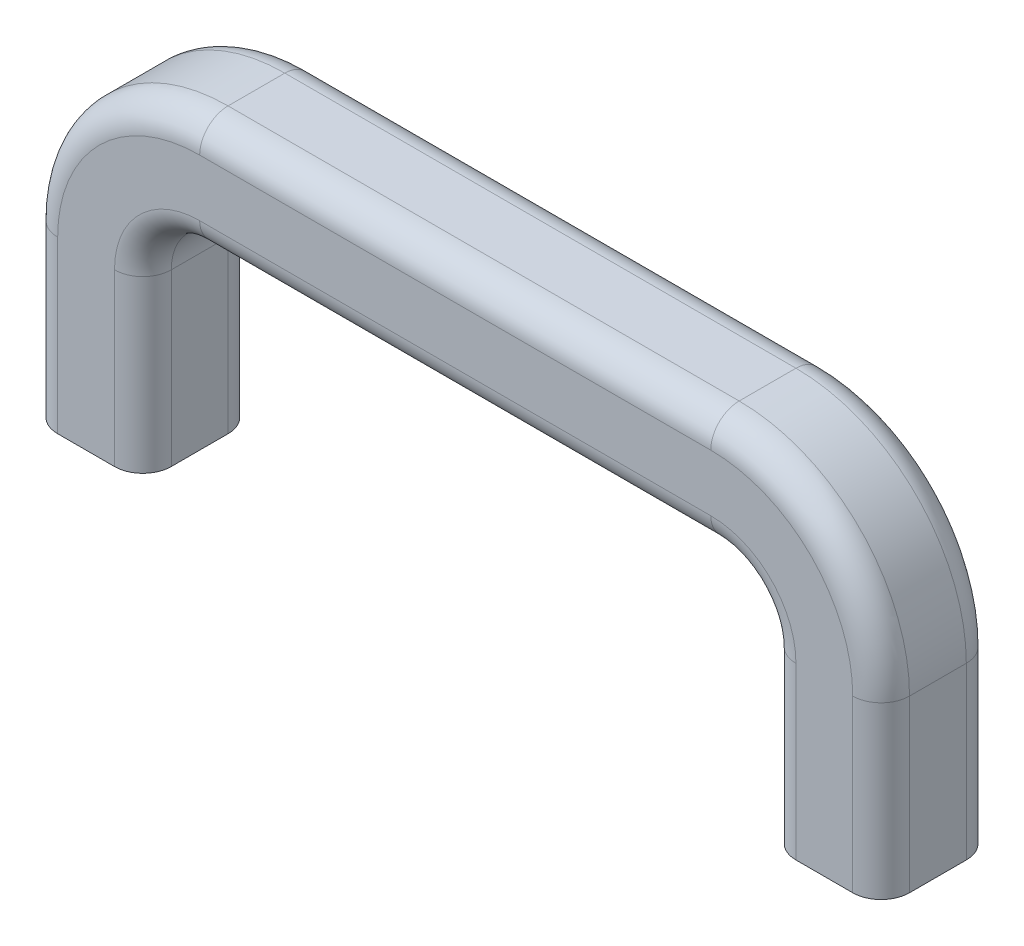
from build123d import *

# Parameters (mm, degrees)
SKICA1_W                 = 150
SKICA1_H                 = 20
P_IDAT_VYSUNUT_M1_DEPTH  = 60
SKICA2_W                 = 110
SKICA2_H                 = 40
ODEBRAT_VYSUNUT_M1_DEPTH = 60
ZAOBLIT1_R               = 10
ZAOBLIT2_R               = 30
ZAOBLIT3_R               = 5


with BuildPart() as part:
    # Skica1 → Přidat vysunutím1 (new body)
    with BuildSketch(Plane(origin=(0, 0, 0), x_dir=(1, 0, 0), z_dir=(0, 1, 0))):
        Rectangle(SKICA1_W, SKICA1_H)
    extrude(amount=P_IDAT_VYSUNUT_M1_DEPTH)

    # Skica2 → Odebrat vysunutím1 (cut)
    with BuildSketch(Plane.XY.offset(10)):
        with Locations((0, 20)):
            Rectangle(SKICA2_W, SKICA2_H)
    extrude(amount=-ODEBRAT_VYSUNUT_M1_DEPTH, mode=Mode.SUBTRACT)

    # Zaoblit1
    zaoblit1_edges = [part.edges().sort_by_distance(p)[0] for p in [
        (55, 40, 0),
        (-55, 40, 0),
    ]]
    fillet(zaoblit1_edges, radius=ZAOBLIT1_R)

    # Zaoblit2
    zaoblit2_edges = [part.edges().sort_by_distance(p)[0] for p in [
        (75, 60, 0),
        (-75, 60, 0),
    ]]
    fillet(zaoblit2_edges, radius=ZAOBLIT2_R)

    # Zaoblit3
    zaoblit3_edges = [part.edges().sort_by_distance(p)[0] for p in [
        (55, 15, -10),
        (52.071067812, 37.071067812, -10),
        (-55, 15, -10),
        (-52.071067812, 37.071067812, -10),
        (55, 15, 10),
        (52.071067812, 37.071067812, 10),
        (-55, 15, 10),
        (-52.071067812, 37.071067812, 10),
        (75, 15, -10),
        (66.213203436, 51.213203436, -10),
        (-75, 15, -10),
        (-66.213203436, 51.213203436, -10),
        (-75, 15, 10),
        (-66.213203436, 51.213203436, 10),
        (75, 15, 10),
        (66.213203436, 51.213203436, 10),
        (0, 40, -10),
        (0, 40, 10),
        (0, 60, -10),
        (0, 60, 10),
    ]]
    fillet(zaoblit3_edges, radius=ZAOBLIT3_R)


solid = part.part
